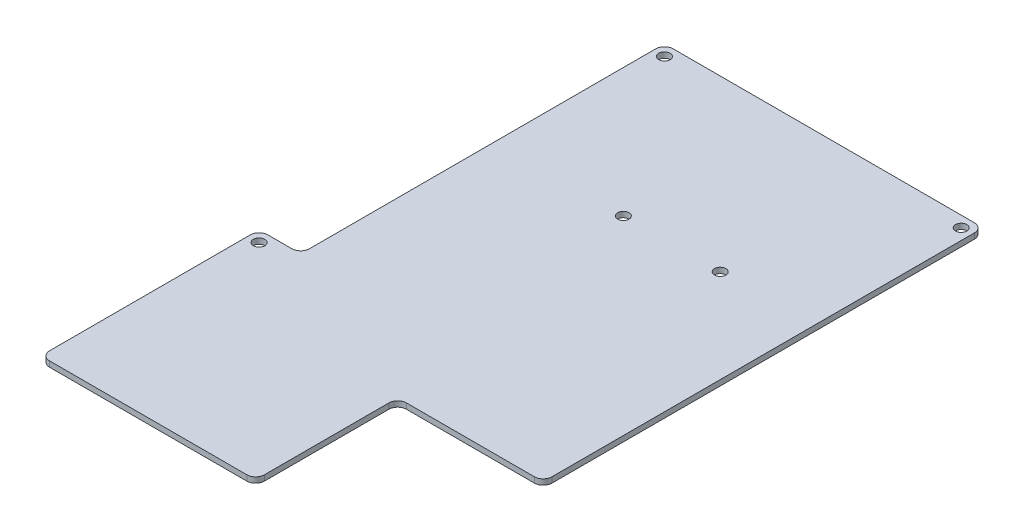
from build123d import *

# Parameters (mm, degrees)
SKETCH1_W                 = 92
SKETCH1_H                 = 127
BOSS_EXTRUDE1_DEPTH       = 1.6
F_4_CLEARANCE_HOLE1_D     = 3.2639
F_4_CLEARANCE_HOLE1_DEPTH = 18.75
F_4_CLEARANCE_HOLE1_TIP   = 0.980574487
F_8_CLEARANCE_HOLE1_D     = 4.4958
F_8_CLEARANCE_HOLE1_DEPTH = 18.75
F_8_CLEARANCE_HOLE1_TIP   = 1.350674586
SKETCH8_W                 = 62
SKETCH8_H                 = 63
BOSS_EXTRUDE2_DEPTH       = 1.6
F_4_CLEARANCE_HOLE2_D     = 3.2639
F_4_CLEARANCE_HOLE2_DEPTH = 50
F_4_CLEARANCE_HOLE2_TIP   = 0.980574487
FILLET1_R                 = 2.54


with BuildPart() as part:
    # Sketch1 → Boss-Extrude1 (new body)
    with BuildSketch(Plane(origin=(0, 0, 0), x_dir=(1, 0, 0), z_dir=(0, 1, 0))):
        Rectangle(SKETCH1_W, SKETCH1_H)
    extrude(amount=BOSS_EXTRUDE1_DEPTH)

    # #4 Clearance Hole1
    with Locations(Plane(origin=(0, 1.6, 0), x_dir=(1, 0, 0), z_dir=(0, 1, 0))):
        with Locations((19.05, 14.54), (-8.89, 14.54)):
            Hole(F_4_CLEARANCE_HOLE1_D / 2, depth=F_4_CLEARANCE_HOLE1_DEPTH)
            with Locations((0, 0, -(F_4_CLEARANCE_HOLE1_DEPTH + F_4_CLEARANCE_HOLE1_TIP / 2))):  # 118° drill point
                Cone(0, F_4_CLEARANCE_HOLE1_D / 2, F_4_CLEARANCE_HOLE1_TIP, mode=Mode.SUBTRACT)

    # #8 Clearance Hole1
    with Locations(Plane(origin=(0, 0, 0), x_dir=(-1, 0, 0), z_dir=(0, -1, 0))):
        with Locations((22.07, -45.25)):
            Hole(F_8_CLEARANCE_HOLE1_D / 2, depth=F_8_CLEARANCE_HOLE1_DEPTH)
            with Locations((0, 0, -(F_8_CLEARANCE_HOLE1_DEPTH + F_8_CLEARANCE_HOLE1_TIP / 2))):  # 118° drill point
                Cone(0, F_8_CLEARANCE_HOLE1_D / 2, F_8_CLEARANCE_HOLE1_TIP, mode=Mode.SUBTRACT)

    # Sketch8 → Boss-Extrude2 (add)
    with BuildSketch(Plane(origin=(0, 0, 0), x_dir=(1, 0, 0), z_dir=(0, 1, 0))):
        with Locations((-27, -73)):
            Rectangle(SKETCH8_W, SKETCH8_H)
    extrude(amount=BOSS_EXTRUDE2_DEPTH)

    # #4 Clearance Hole2
    with Locations(Plane(origin=(0, 1.6, 0), x_dir=(1, 0, 0), z_dir=(0, 1, 0))):
        with Locations((-42.825, 60.325), (42.825, 60.325), (-54.82, -44.68)):
            Hole(F_4_CLEARANCE_HOLE2_D / 2, depth=F_4_CLEARANCE_HOLE2_DEPTH)
            with Locations((0, 0, -(F_4_CLEARANCE_HOLE2_DEPTH + F_4_CLEARANCE_HOLE2_TIP / 2))):  # 118° drill point
                Cone(0, F_4_CLEARANCE_HOLE2_D / 2, F_4_CLEARANCE_HOLE2_TIP, mode=Mode.SUBTRACT)

    # Fillet1
    fillet1_edges = [part.edges().sort_by_distance(p)[0] for p in [
        (46, 0.8, 63.5),
        (46, 0.8, -63.5),
        (-46, 0.8, -63.5),
        (4, 0.8, 63.5),
        (4, 0.8, 104.5),
        (-58, 0.8, 104.5),
        (-58, 0.8, 41.5),
        (-46, 0.8, 41.5),
    ]]
    fillet(fillet1_edges, radius=FILLET1_R)


solid = part.part
